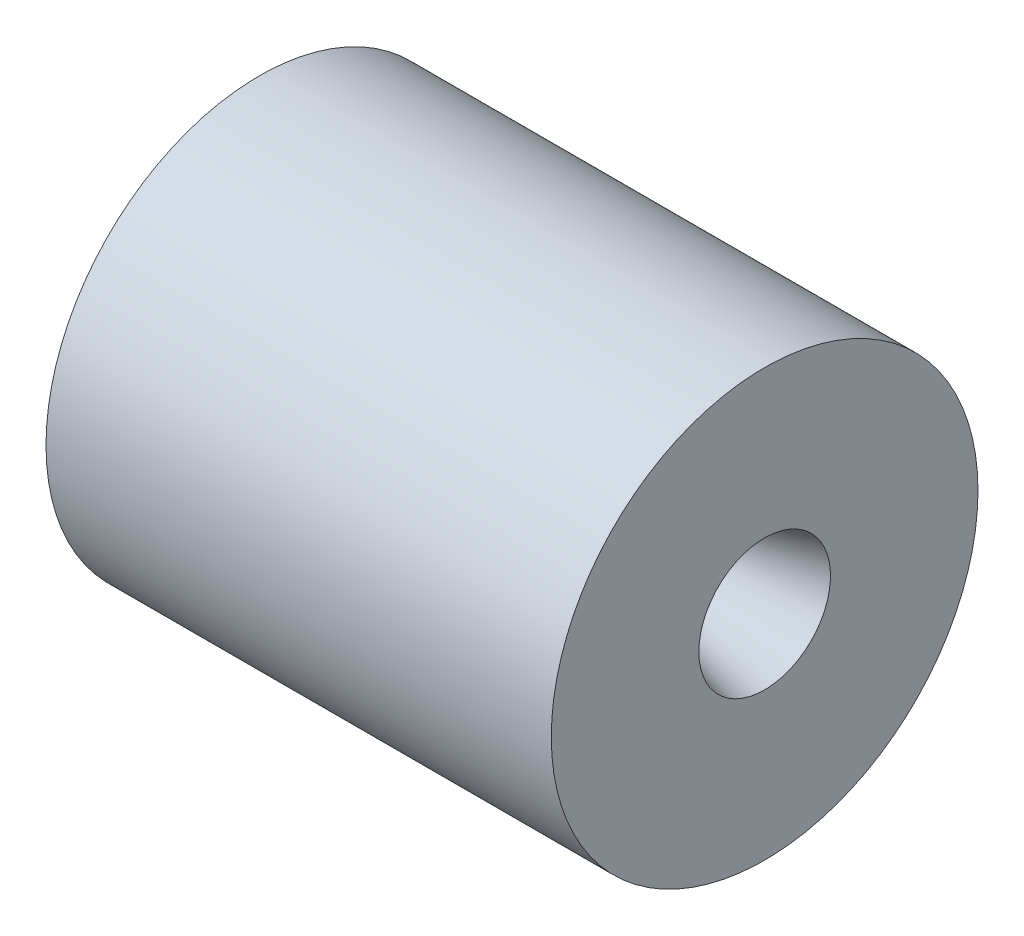
from build123d import *

# Parameters (mm, degrees)
SKETCH3_R          = 6.35
CUT_EXTRUDE2_DEPTH = 25.4


with BuildPart() as part:
    # Sketch1 → Revolve1 (revolve)
    with BuildSketch(Plane.XY):
        with BuildLine():
            Line((0, 45.72), (0, 38.1))
            Line((0, 38.1), (110.897045256, 38.1))
            ThreePointArc((110.897045256, 38.1), (114.184047129, 37.667257994), (117.247045256, 36.398522628))
            Line((117.247045256, 36.398522628), (153.648338424, 15.382226219))
            ThreePointArc((153.648338424, 15.382226219), (157.542961832, 14.060179716), (161.647049978, 14.329175865))
            Line((161.647049978, 14.329175865), (210.545228126, 27.431403211))
            Line((210.545228126, 27.431403211), (210.545228126, 88.9))
            Line((210.545228126, 88.9), (0, 88.9))
            Line((0, 88.9), (0, 55.88))
            Line((0, 55.88), (5.08, 55.88))
            Line((5.08, 55.88), (5.08, 45.72))
            Line((5.08, 45.72), (0, 45.72))
        make_face()
    revolve(axis=Axis((0, 0, 0), (1, 0, 0)))

    # Sketch3 → Cut-Extrude2 (cut)
    with BuildSketch(Plane.ZY):
        with Locations((-69.85, 0)):
            Circle(SKETCH3_R)
        with Locations((-21.584837057, 66.431297663)):
            Circle(SKETCH3_R)
        with Locations((56.509837057, 41.056799873)):
            Circle(SKETCH3_R)
        with Locations((56.509837057, -41.056799873)):
            Circle(SKETCH3_R)
        with Locations((-21.584837057, -66.431297663)):
            Circle(SKETCH3_R)
    extrude(amount=-CUT_EXTRUDE2_DEPTH, mode=Mode.SUBTRACT)


solid = part.part
